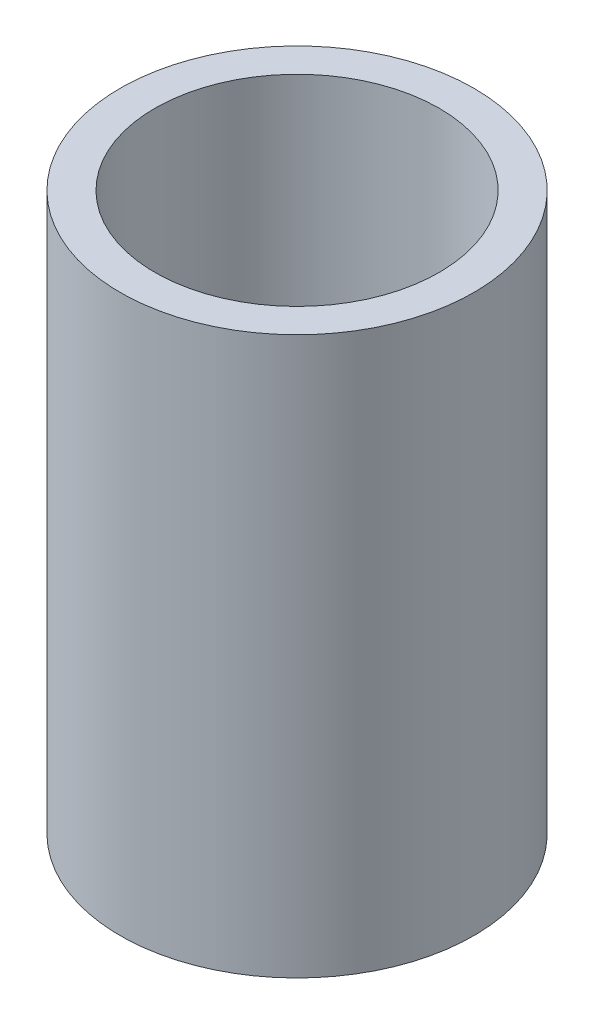
from build123d import *

# Parameters (mm, degrees)
SKETCH1_R           = 6.35
SKETCH1_R_2         = 5.1054
BOSS_EXTRUDE1_DEPTH = 20


with BuildPart() as part:
    # Sketch1 → Boss-Extrude1 (new body)
    with BuildSketch(Plane.XZ.offset(-70.82128008)):
        Circle(SKETCH1_R)
        Circle(SKETCH1_R_2, mode=Mode.SUBTRACT)
    extrude(amount=BOSS_EXTRUDE1_DEPTH)


solid = part.part
